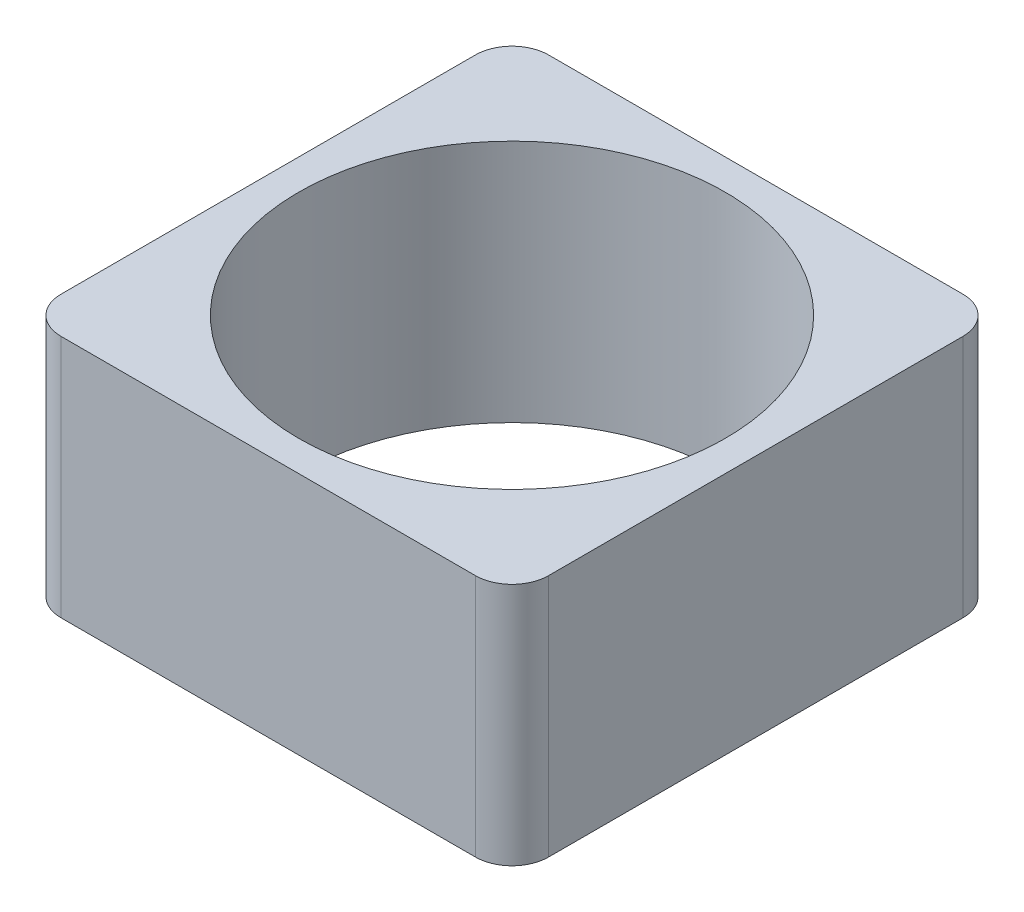
from build123d import *

# Parameters (mm, degrees)
SKETCH1_W           = 40
SKETCH1_H           = 40
BOSS_EXTRUDE1_DEPTH = 20
FILLET1_R           = 3
SKETCH2_R           = 17.5
CUT_EXTRUDE1_DEPTH  = 35.641016151


with BuildPart() as part:
    # Sketch1 → Boss-Extrude1 (new body)
    with BuildSketch(Plane(origin=(0, 0, 0), x_dir=(1, 0, 0), z_dir=(0, 1, 0))):
        Rectangle(SKETCH1_W, SKETCH1_H)
    extrude(amount=BOSS_EXTRUDE1_DEPTH)

    # Fillet1
    fillet1_edges = [part.edges().sort_by_distance(p)[0] for p in [
        (-20, 10, -20),
        (-20, 10, 20),
        (20, 10, -20),
        (20, 10, 20),
    ]]
    fillet(fillet1_edges, radius=FILLET1_R)

    # Sketch2 → Cut-Extrude1 (cut, through all)
    with BuildSketch(Plane(origin=(0, 20, 0), x_dir=(1, 0, 0), z_dir=(0, 1, 0))):
        Circle(SKETCH2_R)
    extrude(amount=-CUT_EXTRUDE1_DEPTH, mode=Mode.SUBTRACT)


solid = part.part
